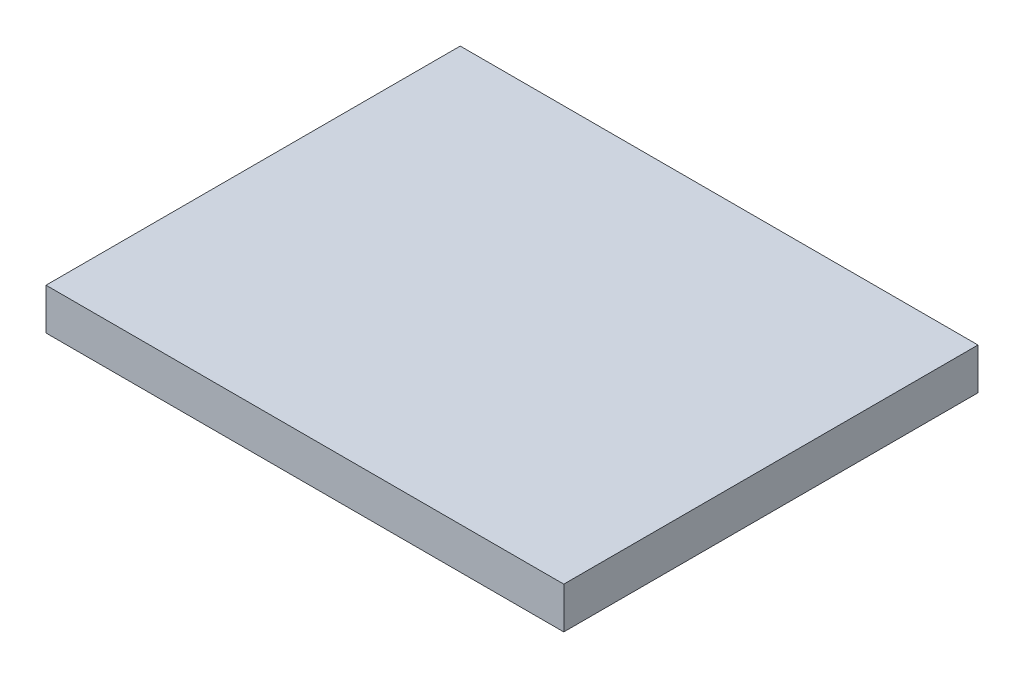
from build123d import *

# Parameters (mm, degrees)
SKETCH1_W           = 500
SKETCH1_H           = 400
BOSS_EXTRUDE1_DEPTH = 40


with BuildPart() as part:
    # Sketch1 → Boss-Extrude1 (new body)
    with BuildSketch(Plane(origin=(0, 0, 0), x_dir=(1, 0, 0), z_dir=(0, 1, 0))):
        Rectangle(SKETCH1_W, SKETCH1_H)
    extrude(amount=BOSS_EXTRUDE1_DEPTH)


solid = part.part
